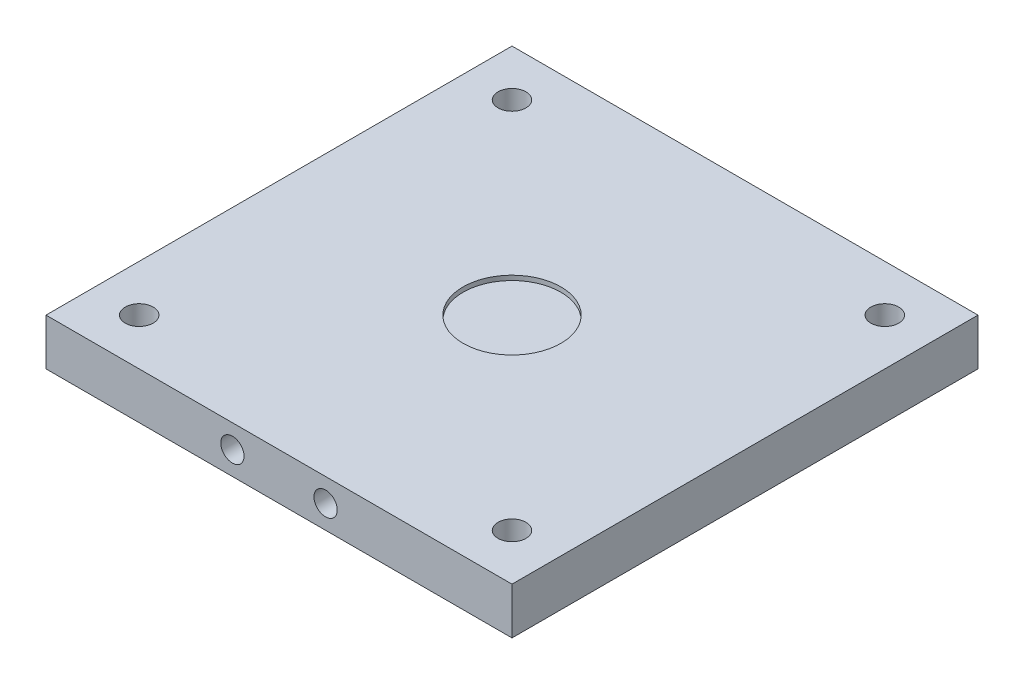
from build123d import *

# Parameters (mm, degrees)
SKETCH1_W           = 100
SKETCH1_H           = 100
BASE_DEPTH          = 10
SKETCH2_R           = 10.5
LOAD_CELL_CUT_DEPTH = 1
CUT_EXTRUDE1_REACH  = 73.414
SKETCH15_R          = 3
SKETCH21_R          = 2.5
CUT_EXTRUDE2_DEPTH  = 10


with BuildPart() as part:
    # Sketch1 → base (new body)
    with BuildSketch(Plane(origin=(0, 0, 0), x_dir=(1, 0, 0), z_dir=(0, 1, 0))):
        Rectangle(SKETCH1_W, SKETCH1_H)
    extrude(amount=BASE_DEPTH)

    # Sketch2 → load cell cut (cut)
    with BuildSketch(Plane(origin=(0, 10, 0), x_dir=(1, 0, 0), z_dir=(0, 1, 0))):
        Circle(SKETCH2_R)
    extrude(amount=-LOAD_CELL_CUT_DEPTH, mode=Mode.SUBTRACT)

    # Sketch15 → Cut-Extrude1 (cut, up to next)
    with BuildSketch(Plane(origin=(0, 0, 0), x_dir=(-1, 0, 0), z_dir=(0, -1, 0)), mode=Mode.PRIVATE) as cut_extrude1_sk1:
        with Locations((40, -40)):
            Circle(SKETCH15_R)
    cut_extrude1_tool1 = extrude(cut_extrude1_sk1.sketch, amount=-CUT_EXTRUDE1_REACH, mode=Mode.PRIVATE) & part.part
    # Sketch15 → Cut-Extrude1 (cut, up to next)
    with BuildSketch(Plane(origin=(0, 0, 0), x_dir=(-1, 0, 0), z_dir=(0, -1, 0)), mode=Mode.PRIVATE) as cut_extrude1_sk2:
        with Locations((-40, -40)):
            Circle(SKETCH15_R)
    cut_extrude1_tool2 = extrude(cut_extrude1_sk2.sketch, amount=-CUT_EXTRUDE1_REACH, mode=Mode.PRIVATE) & part.part
    # Sketch15 → Cut-Extrude1 (cut, up to next)
    with BuildSketch(Plane(origin=(0, 0, 0), x_dir=(-1, 0, 0), z_dir=(0, -1, 0)), mode=Mode.PRIVATE) as cut_extrude1_sk3:
        with Locations((40, 40)):
            Circle(SKETCH15_R)
    cut_extrude1_tool3 = extrude(cut_extrude1_sk3.sketch, amount=-CUT_EXTRUDE1_REACH, mode=Mode.PRIVATE) & part.part
    # Sketch15 → Cut-Extrude1 (cut, up to next)
    with BuildSketch(Plane(origin=(0, 0, 0), x_dir=(-1, 0, 0), z_dir=(0, -1, 0)), mode=Mode.PRIVATE) as cut_extrude1_sk4:
        with Locations((-40, 40)):
            Circle(SKETCH15_R)
    cut_extrude1_tool4 = extrude(cut_extrude1_sk4.sketch, amount=-CUT_EXTRUDE1_REACH, mode=Mode.PRIVATE) & part.part
    add(cut_extrude1_tool1.solids().sort_by_distance((-40, 0, 40))[0], mode=Mode.SUBTRACT)
    add(cut_extrude1_tool2.solids().sort_by_distance((40, 0, 40))[0], mode=Mode.SUBTRACT)
    add(cut_extrude1_tool3.solids().sort_by_distance((-40, 0, -40))[0], mode=Mode.SUBTRACT)
    add(cut_extrude1_tool4.solids().sort_by_distance((40, 0, -40))[0], mode=Mode.SUBTRACT)

    # Sketch21 → Cut-Extrude2 (cut)
    with BuildSketch(Plane(origin=(0, 0, -50), x_dir=(-1, 0, 0), z_dir=(0, 0, -1))):
        with Locations((-10, 5)):
            Circle(SKETCH21_R)
        with Locations((10, 5)):
            Circle(SKETCH21_R)
    cut_extrude2 = extrude(amount=-CUT_EXTRUDE2_DEPTH, mode=Mode.SUBTRACT)

    # Mirror2: Cut-Extrude2 across plane
    add(cut_extrude2.mirror(Plane.XY), mode=Mode.SUBTRACT)


solid = part.part
